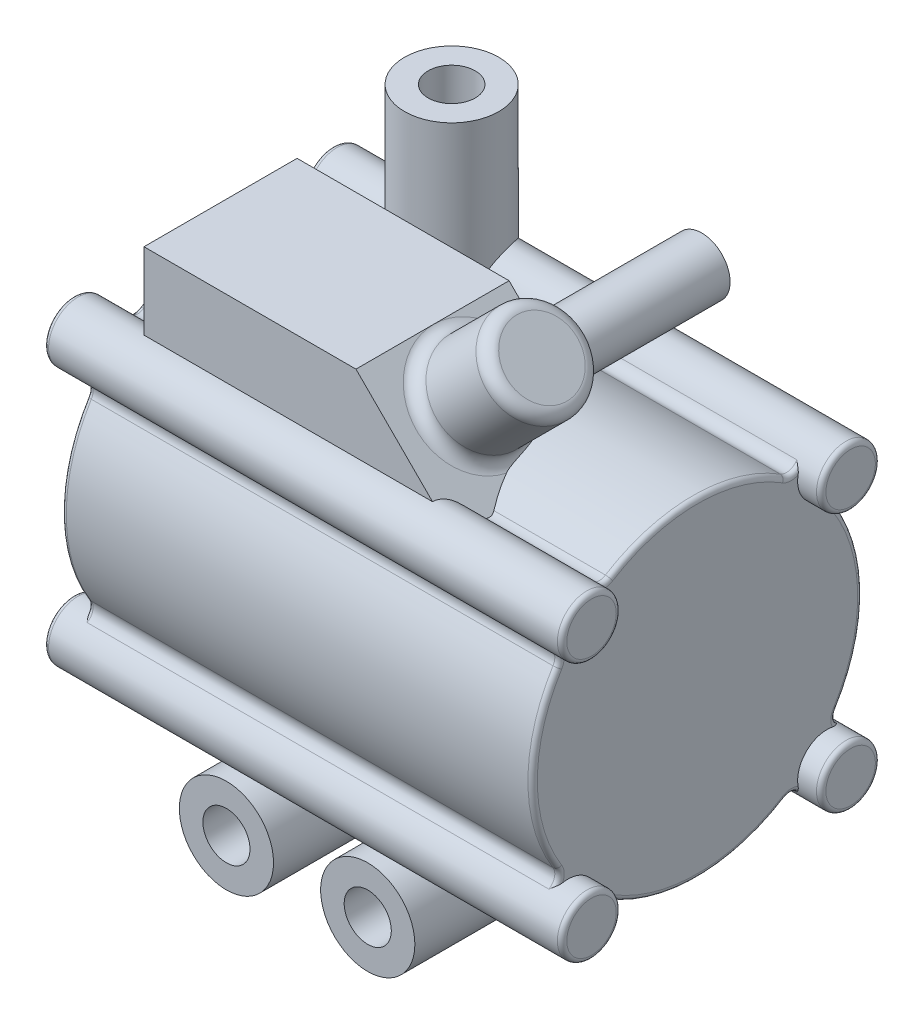
from build123d import *
from build123d.topology import SkipClean

# Parameters (mm, degrees)
BOSS_EXTRUDE1_DEPTH      = 50
BOSS_EXTRUDE1_DEPTH_BACK = 50
BOSS_EXTRUDE2_DEPTH      = 55
BOSS_EXTRUDE2_DEPTH_BACK = 55
SKETCH2_R                = 6.25
FILLET1_R                = 1
FILLET2_R                = 1
BOSS_EXTRUDE3_DEPTH      = 35
BOSS_EXTRUDE3_DEPTH_BACK = 35
SKETCH3_R                = 10
SKETCH3_R_2              = 5
SKETCH4_R                = 10
SKETCH4_R_2              = 5
BOSS_EXTRUDE5_DEPTH      = 60
BOSS_EXTRUDE6_DEPTH      = 27.5
BOSS_EXTRUDE6_DEPTH_BACK = 5
SKETCH8_R                = 10
BOSS_EXTRUDE7_DEPTH      = 20
BOSS_EXTRUDE8_DEPTH      = 10
BOSS_EXTRUDE8_DEPTH_BACK = 30
SKETCH9_R                = 6
SKETCH9_R_2              = 4
FILLET3_R                = 2.5
SKETCH10_R               = 7.5
CUT_EXTRUDE1_DEPTH       = 20
BOSS_EXTRUDE9_START      = 7.5
SKETCH11_R               = 10
SKETCH11_R_2             = 7.5
BOSS_EXTRUDE9_DEPTH      = 7.5


with BuildPart() as part:
    # Sketch1 → Boss-Extrude1 (new, two sides: drawn at the far end of the back side and taken through both)
    with BuildSketch(Plane(origin=(0, 0, 0), x_dir=(0, 0, -1), z_dir=(1, 0, 0)).offset(-BOSS_EXTRUDE1_DEPTH_BACK)):
        with BuildLine():
            ThreePointArc((18.553049004, 29.678011602), (0, 35), (-18.553049004, 29.678011602))
            ThreePointArc((-18.553049004, 29.678011602), (-20.495133355, 29.375169501), (-22.05590485, 30.569906838))
            ThreePointArc((-22.05590485, 30.569906838), (-31.919417382, 31.919417382), (-30.569906838, 22.05590485))
            ThreePointArc((-30.569906838, 22.05590485), (-29.375169501, 20.495133355), (-29.678011602, 18.553049004))
            ThreePointArc((-29.678011602, 18.553049004), (-35, 0), (-29.678011602, -18.553049004))
            ThreePointArc((-29.678011602, -18.553049004), (-29.375169501, -20.495133355), (-30.569906838, -22.05590485))
            ThreePointArc((-30.569906838, -22.05590485), (-31.919417382, -31.919417382), (-22.05590485, -30.569906838))
            ThreePointArc((-22.05590485, -30.569906838), (-20.495133355, -29.375169501), (-18.553049004, -29.678011602))
            ThreePointArc((-18.553049004, -29.678011602), (0, -35), (18.553049004, -29.678011602))
            ThreePointArc((18.553049004, -29.678011602), (20.495133355, -29.375169501), (22.05590485, -30.569906838))
            ThreePointArc((22.05590485, -30.569906838), (31.919417382, -31.919417382), (30.569906838, -22.05590485))
            ThreePointArc((30.569906838, -22.05590485), (29.375169501, -20.495133355), (29.678011602, -18.553049004))
            ThreePointArc((29.678011602, -18.553049004), (35, 0), (29.678011602, 18.553049004))
            ThreePointArc((29.678011602, 18.553049004), (29.375169501, 20.495133355), (30.569906838, 22.05590485))
            ThreePointArc((30.569906838, 22.05590485), (31.919417382, 31.919417382), (22.05590485, 30.569906838))
            ThreePointArc((22.05590485, 30.569906838), (20.495133355, 29.375169501), (18.553049004, 29.678011602))
        make_face()
    extrude(amount=BOSS_EXTRUDE1_DEPTH + BOSS_EXTRUDE1_DEPTH_BACK)

    # Sketch2 → Boss-Extrude2 (add, two sides: drawn at the far end of the back side and taken through both)
    with SkipClean():  # the faces are left unmerged after this step: merging them gives an invalid solid
        with BuildSketch(Plane(origin=(0, 0, 0), x_dir=(0, 0, -1), z_dir=(1, 0, 0)).offset(-BOSS_EXTRUDE2_DEPTH_BACK)):
            with Locations((-27.5, 27.5)):
                Circle(SKETCH2_R)
            with Locations((27.5, 27.5)):
                Circle(SKETCH2_R)
            with Locations((27.5, -27.5)):
                Circle(SKETCH2_R)
            with Locations((-27.5, -27.5)):
                Circle(SKETCH2_R)
        extrude(amount=BOSS_EXTRUDE2_DEPTH + BOSS_EXTRUDE2_DEPTH_BACK)
    add(part.part.scale(1), mode=Mode.REPLACE)  # the faces are merged on a copy

    # Fillet1
    fillet1_edges = [part.edges().sort_by_distance(p)[0] for p in [
        (-55, -27.5, 33.75),
        (55, -27.5, 33.75),
        (-55, 27.5, 33.75),
        (55, 27.5, 33.75),
        (-55, 27.5, -21.25),
        (55, 27.5, -21.25),
        (-55, -27.5, -21.25),
        (55, -27.5, -21.25),
    ]]
    fillet(fillet1_edges, radius=FILLET1_R)

    # Fillet2
    # the kernel refuses this fillet: 1 mm, written as the material it takes off along each edge
    with BuildSketch(Plane(origin=(50, 31.797869574, -19.87826679), x_dir=(0, 0.46795506701056017, -0.8837522589838976), z_dir=(0, 0.8837522589838976, 0.46795506701056017))) as fillet2_piece_1_section:
        with BuildLine():
            CenterArc((2.5 + FILLET2_R, FILLET2_R), FILLET2_R, 180, 90)
            Line((2.5 + FILLET2_R, 0), (2.5, 0))
            Line((2.5, 0), (2.5, FILLET2_R))
        make_face()
    fillet2_piece_1 = revolve(axis=Axis((50, 31.797869574, -19.87826679), (-1, 0, 0)), revolution_arc=149.912978169, mode=Mode.PRIVATE)
    fillet2_piece_1 = fillet2_piece_1 - Plane(origin=(49.747342596, 27.5, -27.5), x_dir=(0, 0, -1), z_dir=(-1, 0, 0)) * Cylinder(6.25, 15, mode=Mode.PRIVATE)
    add(fillet2_piece_1, mode=Mode.SUBTRACT)
    with BuildSketch(Plane(origin=(50, 0, 0), x_dir=(0, 0.8479431886343233, -0.5300871143959797), z_dir=(0, -0.5300871143959797, -0.8479431886343233))) as fillet2_piece_2:
        with BuildLine():
            CenterArc((35 - FILLET2_R, -FILLET2_R), FILLET2_R, 0, 90)
            Line((35, -FILLET2_R), (35, 0))
            Line((35, 0), (35 - FILLET2_R, 0))
        make_face()
    revolve(axis=Axis((50, 0, 0), (1, 0, 0)), revolution_arc=64.02268197, mode=Mode.SUBTRACT)
    with BuildSketch(Plane(origin=(50, 31.797869574, 19.87826679), x_dir=(0, -0.8479431886343237, -0.5300871143959789), z_dir=(0, 0.5300871143959789, -0.8479431886343237))) as fillet2_piece_3_section:
        with BuildLine():
            CenterArc((2.5 + FILLET2_R, FILLET2_R), FILLET2_R, 180, 90)
            Line((2.5, FILLET2_R), (2.5, 0))
            Line((2.5, 0), (2.5 + FILLET2_R, 0))
        make_face()
    fillet2_piece_3 = revolve(axis=Axis((50, 31.797869574, 19.87826679), (-1, 0, 0)), revolution_arc=149.912978169, mode=Mode.PRIVATE)
    fillet2_piece_3 = fillet2_piece_3 - Plane(origin=(49.836395702, 27.5, 27.5), x_dir=(0, 0, -1), z_dir=(-1, 0, 0)) * Cylinder(6.25, 15, mode=Mode.PRIVATE)
    add(fillet2_piece_3, mode=Mode.SUBTRACT)
    with BuildSketch(Plane(origin=(50, 19.87826679, 31.797869574), x_dir=(0, 0.8837522589838976, 0.46795506701056017), z_dir=(0, -0.46795506701056017, 0.8837522589838976))) as fillet2_piece_4_section:
        with BuildLine():
            CenterArc((2.5 + FILLET2_R, FILLET2_R), FILLET2_R, 180, 90)
            Line((2.5, FILLET2_R), (2.5, 0))
            Line((2.5, 0), (2.5 + FILLET2_R, 0))
        make_face()
    fillet2_piece_4 = revolve(axis=Axis((50, 19.87826679, 31.797869574), (-1, 0, 0)), revolution_arc=149.912978169, mode=Mode.PRIVATE)
    fillet2_piece_4 = fillet2_piece_4 - Plane(origin=(49.747342634, 27.5, 27.5), x_dir=(0, 0, -1), z_dir=(-1, 0, 0)) * Cylinder(6.25, 15, mode=Mode.PRIVATE)
    add(fillet2_piece_4, mode=Mode.SUBTRACT)
    with BuildSketch(Plane(origin=(50, 0, 0), x_dir=(0, 0.5300871143959798, 0.8479431886343232), z_dir=(0, 0.8479431886343232, -0.5300871143959798))) as fillet2_piece_5:
        with BuildLine():
            CenterArc((35 - FILLET2_R, -FILLET2_R), FILLET2_R, 0, 90)
            Line((35, -FILLET2_R), (35, 0))
            Line((35, 0), (35 - FILLET2_R, 0))
        make_face()
    revolve(axis=Axis((50, 0, 0), (1, 0, 0)), revolution_arc=64.02268197, mode=Mode.SUBTRACT)
    with BuildSketch(Plane(origin=(50, -19.87826679, 31.797869574), x_dir=(0, 0.5300871143959799, -0.8479431886343232), z_dir=(0, 0.8479431886343232, 0.5300871143959799))) as fillet2_piece_6_section:
        with BuildLine():
            CenterArc((2.5 + FILLET2_R, FILLET2_R), FILLET2_R, 180, 90)
            Line((2.5, FILLET2_R), (2.5, 0))
            Line((2.5, 0), (2.5 + FILLET2_R, 0))
        make_face()
    fillet2_piece_6 = revolve(axis=Axis((50, -19.87826679, 31.797869574), (-1, 0, 0)), revolution_arc=149.912978169, mode=Mode.PRIVATE)
    fillet2_piece_6 = fillet2_piece_6 - Plane(origin=(49.836395702, -27.5, 27.5), x_dir=(0, 0, -1), z_dir=(-1, 0, 0)) * Cylinder(6.25, 15, mode=Mode.PRIVATE)
    add(fillet2_piece_6, mode=Mode.SUBTRACT)
    with BuildSketch(Plane(origin=(-50, 19.87826679, -31.797869574), x_dir=(0, -0.5300871143959834, 0.8479431886343209), z_dir=(0, -0.8479431886343209, -0.5300871143959834))) as fillet2_piece_7_section:
        with BuildLine():
            CenterArc((2.5 + FILLET2_R, -FILLET2_R), FILLET2_R, 90, 90)
            Line((2.5, -FILLET2_R), (2.5, 0))
            Line((2.5, 0), (2.5 + FILLET2_R, 0))
        make_face()
    fillet2_piece_7 = revolve(axis=Axis((-50, 19.87826679, -31.797869574), (-1, 0, 0)), revolution_arc=149.912978169, mode=Mode.PRIVATE)
    fillet2_piece_7 = fillet2_piece_7 - Plane(origin=(-49.836395702, 27.5, -27.5), x_dir=(0, 0, -1), z_dir=(-1, 0, 0)) * Cylinder(6.25, 14, mode=Mode.PRIVATE)
    add(fillet2_piece_7, mode=Mode.SUBTRACT)
    with BuildSketch(Plane(origin=(-50, 0, 0), x_dir=(0, -0.5300871143959799, -0.8479431886343232), z_dir=(0, -0.8479431886343232, 0.5300871143959799))) as fillet2_piece_8:
        with BuildLine():
            CenterArc((35 - FILLET2_R, FILLET2_R), FILLET2_R, 270, 90)
            Line((35, FILLET2_R), (35, 0))
            Line((35, 0), (35 - FILLET2_R, 0))
        make_face()
    revolve(axis=Axis((-50, 0, 0), (1, 0, 0)), revolution_arc=64.02268197, mode=Mode.SUBTRACT)
    with BuildSketch(Plane(origin=(-50, -19.87826679, -31.797869574), x_dir=(0, -0.8837522589838976, -0.46795506701056017), z_dir=(0, 0.46795506701056017, -0.8837522589838976))) as fillet2_piece_9_section:
        with BuildLine():
            CenterArc((2.5 + FILLET2_R, -FILLET2_R), FILLET2_R, 90, 90)
            Line((2.5, -FILLET2_R), (2.5, 0))
            Line((2.5, 0), (2.5 + FILLET2_R, 0))
        make_face()
    fillet2_piece_9 = revolve(axis=Axis((-50, -19.87826679, -31.797869574), (-1, 0, 0)), revolution_arc=149.912978169, mode=Mode.PRIVATE)
    fillet2_piece_9 = fillet2_piece_9 - Plane(origin=(-49.747342593, -27.5, -27.5), x_dir=(0, -0.49118509414709893, 0.8710552240172293), z_dir=(-1, 0, 0)) * Cylinder(6.25, 15, mode=Mode.PRIVATE)
    add(fillet2_piece_9, mode=Mode.SUBTRACT)
    with BuildSketch(Plane(origin=(-50, -31.797869574, -19.87826679), x_dir=(0, 0.8479431886343237, 0.5300871143959789), z_dir=(0, -0.5300871143959789, 0.8479431886343237))) as fillet2_piece_10_section:
        with BuildLine():
            CenterArc((2.5 + FILLET2_R, -FILLET2_R), FILLET2_R, 90, 90)
            Line((2.5, -FILLET2_R), (2.5, 0))
            Line((2.5, 0), (2.5 + FILLET2_R, 0))
        make_face()
    fillet2_piece_10 = revolve(axis=Axis((-50, -31.797869574, -19.87826679), (-1, 0, 0)), revolution_arc=149.912978169, mode=Mode.PRIVATE)
    fillet2_piece_10 = fillet2_piece_10 - Plane(origin=(-49.836395702, -27.5, -27.5), x_dir=(0, -0.49118509414709893, 0.8710552240172293), z_dir=(-1, 0, 0)) * Cylinder(6.25, 15, mode=Mode.PRIVATE)
    add(fillet2_piece_10, mode=Mode.SUBTRACT)
    with BuildSketch(Plane(origin=(-50, 0, 0), x_dir=(0, -0.8479431886343233, 0.5300871143959798), z_dir=(0, 0.5300871143959798, 0.8479431886343233))) as fillet2_piece_11:
        with BuildLine():
            CenterArc((35 - FILLET2_R, FILLET2_R), FILLET2_R, 270, 90)
            Line((35, FILLET2_R), (35, 0))
            Line((35, 0), (35 - FILLET2_R, 0))
        make_face()
    revolve(axis=Axis((-50, 0, 0), (1, 0, 0)), revolution_arc=64.02268197, mode=Mode.SUBTRACT)
    with BuildSketch(Plane(origin=(-50, -31.797869574, 19.87826679), x_dir=(0, -0.46795506701056017, 0.8837522589838976), z_dir=(0, -0.8837522589838976, -0.46795506701056017))) as fillet2_piece_12_section:
        with BuildLine():
            CenterArc((2.5 + FILLET2_R, -FILLET2_R), FILLET2_R, 90, 90)
            Line((2.5, -FILLET2_R), (2.5, 0))
            Line((2.5, 0), (2.5 + FILLET2_R, 0))
        make_face()
    fillet2_piece_12 = revolve(axis=Axis((-50, -31.797869574, 19.87826679), (-1, 0, 0)), revolution_arc=149.912978169, mode=Mode.PRIVATE)
    fillet2_piece_12 = fillet2_piece_12 - Plane(origin=(-49.747302505, -27.5, 27.5), x_dir=(0, 0, -1), z_dir=(-1, 0, 0)) * Cylinder(6.25, 15, mode=Mode.PRIVATE)
    add(fillet2_piece_12, mode=Mode.SUBTRACT)
    with BuildSketch(Plane(origin=(-50, -19.87826679, 31.797869574), x_dir=(0, 0.5300871143959799, -0.8479431886343232), z_dir=(0, 0.8479431886343232, 0.5300871143959799))) as fillet2_piece_13_section:
        with BuildLine():
            CenterArc((2.5 + FILLET2_R, -FILLET2_R), FILLET2_R, 90, 90)
            Line((2.5, -FILLET2_R), (2.5, 0))
            Line((2.5, 0), (2.5 + FILLET2_R, 0))
        make_face()
    fillet2_piece_13 = revolve(axis=Axis((-50, -19.87826679, 31.797869574), (-1, 0, 0)), revolution_arc=149.912978169, mode=Mode.PRIVATE)
    fillet2_piece_13 = fillet2_piece_13 - Plane(origin=(-49.836395702, -27.5, 27.5), x_dir=(0, 0, -1), z_dir=(-1, 0, 0)) * Cylinder(6.25, 15, mode=Mode.PRIVATE)
    add(fillet2_piece_13, mode=Mode.SUBTRACT)
    with BuildSketch(Plane(origin=(-50, 0, 0), x_dir=(0, 0.5300871143959798, 0.8479431886343232), z_dir=(0, 0.8479431886343232, -0.5300871143959798))) as fillet2_piece_14:
        with BuildLine():
            CenterArc((35 - FILLET2_R, FILLET2_R), FILLET2_R, 270, 90)
            Line((35, FILLET2_R), (35, 0))
            Line((35, 0), (35 - FILLET2_R, 0))
        make_face()
    revolve(axis=Axis((-50, 0, 0), (1, 0, 0)), revolution_arc=64.02268197, mode=Mode.SUBTRACT)
    with BuildSketch(Plane(origin=(-50, 19.87826679, 31.797869574), x_dir=(0, 0.8837522589838976, 0.46795506701056017), z_dir=(0, -0.46795506701056017, 0.8837522589838976))) as fillet2_piece_15_section:
        with BuildLine():
            CenterArc((2.5 + FILLET2_R, -FILLET2_R), FILLET2_R, 90, 90)
            Line((2.5, -FILLET2_R), (2.5, 0))
            Line((2.5, 0), (2.5 + FILLET2_R, 0))
        make_face()
    fillet2_piece_15 = revolve(axis=Axis((-50, 19.87826679, 31.797869574), (-1, 0, 0)), revolution_arc=149.912978169, mode=Mode.PRIVATE)
    fillet2_piece_15 = fillet2_piece_15 - Plane(origin=(-49.747342634, 27.5, 27.5), x_dir=(0, 0, -1), z_dir=(-1, 0, 0)) * Cylinder(6.25, 15, mode=Mode.PRIVATE)
    add(fillet2_piece_15, mode=Mode.SUBTRACT)
    with BuildSketch(Plane(origin=(-50, 31.797869574, 19.87826679), x_dir=(0, -0.8479431886343237, -0.5300871143959789), z_dir=(0, 0.5300871143959789, -0.8479431886343237))) as fillet2_piece_16_section:
        with BuildLine():
            CenterArc((2.5 + FILLET2_R, -FILLET2_R), FILLET2_R, 90, 90)
            Line((2.5, -FILLET2_R), (2.5, 0))
            Line((2.5, 0), (2.5 + FILLET2_R, 0))
        make_face()
    fillet2_piece_16 = revolve(axis=Axis((-50, 31.797869574, 19.87826679), (-1, 0, 0)), revolution_arc=149.912978169, mode=Mode.PRIVATE)
    fillet2_piece_16 = fillet2_piece_16 - Plane(origin=(-49.836395702, 27.5, 27.5), x_dir=(0, 0, -1), z_dir=(-1, 0, 0)) * Cylinder(6.25, 15, mode=Mode.PRIVATE)
    add(fillet2_piece_16, mode=Mode.SUBTRACT)
    with BuildSketch(Plane(origin=(-50, 0, 0), x_dir=(0, 0.8479431886343233, -0.5300871143959797), z_dir=(0, -0.5300871143959797, -0.8479431886343233))) as fillet2_piece_17:
        with BuildLine():
            CenterArc((35 - FILLET2_R, FILLET2_R), FILLET2_R, 270, 90)
            Line((35, FILLET2_R), (35, 0))
            Line((35, 0), (35 - FILLET2_R, 0))
        make_face()
    revolve(axis=Axis((-50, 0, 0), (1, 0, 0)), revolution_arc=64.02268197, mode=Mode.SUBTRACT)
    with BuildSketch(Plane(origin=(-50, 31.797869574, -19.87826679), x_dir=(0, 0.46795506701056017, -0.8837522589838976), z_dir=(0, 0.8837522589838976, 0.46795506701056017))) as fillet2_piece_18_section:
        with BuildLine():
            CenterArc((2.5 + FILLET2_R, -FILLET2_R), FILLET2_R, 90, 90)
            Line((2.5, -FILLET2_R), (2.5, 0))
            Line((2.5, 0), (2.5 + FILLET2_R, 0))
        make_face()
    fillet2_piece_18 = revolve(axis=Axis((-50, 31.797869574, -19.87826679), (-1, 0, 0)), revolution_arc=149.912978169, mode=Mode.PRIVATE)
    fillet2_piece_18 = fillet2_piece_18 - Plane(origin=(-49.747342593, 27.5, -27.5), x_dir=(0, 0, -1), z_dir=(-1, 0, 0)) * Cylinder(6.25, 15, mode=Mode.PRIVATE)
    add(fillet2_piece_18, mode=Mode.SUBTRACT)
    with BuildSketch(Plane(origin=(50, -31.797869574, 19.87826679), x_dir=(0, -0.46795506701056017, 0.8837522589838976), z_dir=(0, -0.8837522589838976, -0.46795506701056017))) as fillet2_piece_19_section:
        with BuildLine():
            CenterArc((2.5 + FILLET2_R, FILLET2_R), FILLET2_R, 180, 90)
            Line((2.5, FILLET2_R), (2.5, 0))
            Line((2.5, 0), (2.5 + FILLET2_R, 0))
        make_face()
    fillet2_piece_19 = revolve(axis=Axis((50, -31.797869574, 19.87826679), (-1, 0, 0)), revolution_arc=149.912978169, mode=Mode.PRIVATE)
    fillet2_piece_19 = fillet2_piece_19 - Plane(origin=(49.747302505, -27.5, 27.5), x_dir=(0, 0, -1), z_dir=(-1, 0, 0)) * Cylinder(6.25, 15, mode=Mode.PRIVATE)
    add(fillet2_piece_19, mode=Mode.SUBTRACT)
    with BuildSketch(Plane(origin=(50, 0, 0), x_dir=(0, -0.8479431886343233, 0.5300871143959798), z_dir=(0, 0.5300871143959798, 0.8479431886343233))) as fillet2_piece_20:
        with BuildLine():
            CenterArc((35 - FILLET2_R, -FILLET2_R), FILLET2_R, 0, 90)
            Line((35, -FILLET2_R), (35, 0))
            Line((35, 0), (35 - FILLET2_R, 0))
        make_face()
    revolve(axis=Axis((50, 0, 0), (1, 0, 0)), revolution_arc=64.02268197, mode=Mode.SUBTRACT)
    with BuildSketch(Plane(origin=(50, 19.87826679, -31.797869574), x_dir=(0, -0.5300871143959834, 0.8479431886343209), z_dir=(0, -0.8479431886343209, -0.5300871143959834))) as fillet2_piece_21_section:
        with BuildLine():
            CenterArc((2.5 + FILLET2_R, FILLET2_R), FILLET2_R, 180, 90)
            Line((2.5 + FILLET2_R, 0), (2.5, 0))
            Line((2.5, 0), (2.5, FILLET2_R))
        make_face()
    fillet2_piece_21 = revolve(axis=Axis((50, 19.87826679, -31.797869574), (-1, 0, 0)), revolution_arc=149.912978169, mode=Mode.PRIVATE)
    fillet2_piece_21 = fillet2_piece_21 - Plane(origin=(49.747342594, 27.5, -27.5), x_dir=(0, 0, -1), z_dir=(-1, 0, 0)) * Cylinder(6.25, 14, mode=Mode.PRIVATE)
    add(fillet2_piece_21, mode=Mode.SUBTRACT)
    with BuildSketch(Plane(origin=(50, -31.797869574, -19.87826679), x_dir=(0, 0.8479431886343237, 0.5300871143959789), z_dir=(0, -0.5300871143959789, 0.8479431886343237))) as fillet2_piece_22_section:
        with BuildLine():
            CenterArc((2.5 + FILLET2_R, FILLET2_R), FILLET2_R, 180, 90)
            Line((2.5, FILLET2_R), (2.5, 0))
            Line((2.5, 0), (2.5 + FILLET2_R, 0))
        make_face()
    fillet2_piece_22 = revolve(axis=Axis((50, -31.797869574, -19.87826679), (-1, 0, 0)), revolution_arc=149.912978169, mode=Mode.PRIVATE)
    fillet2_piece_22 = fillet2_piece_22 - Plane(origin=(49.836395702, -27.5, -27.5), x_dir=(0, -0.49118509414709893, 0.8710552240172293), z_dir=(-1, 0, 0)) * Cylinder(6.25, 15, mode=Mode.PRIVATE)
    add(fillet2_piece_22, mode=Mode.SUBTRACT)
    with BuildSketch(Plane(origin=(50, -19.87826679, -31.797869574), x_dir=(0, -0.8837522589838976, -0.46795506701056017), z_dir=(0, 0.46795506701056017, -0.8837522589838976))) as fillet2_piece_23_section:
        with BuildLine():
            CenterArc((2.5 + FILLET2_R, FILLET2_R), FILLET2_R, 180, 90)
            Line((2.5, FILLET2_R), (2.5, 0))
            Line((2.5, 0), (2.5 + FILLET2_R, 0))
        make_face()
    fillet2_piece_23 = revolve(axis=Axis((50, -19.87826679, -31.797869574), (-1, 0, 0)), revolution_arc=149.912978169, mode=Mode.PRIVATE)
    fillet2_piece_23 = fillet2_piece_23 - Plane(origin=(49.747342593, -27.5, -27.5), x_dir=(0, -0.49118509414709893, 0.8710552240172293), z_dir=(-1, 0, 0)) * Cylinder(6.25, 15, mode=Mode.PRIVATE)
    add(fillet2_piece_23, mode=Mode.SUBTRACT)
    with BuildSketch(Plane(origin=(50, 0, 0), x_dir=(0, -0.5300871143959799, -0.8479431886343232), z_dir=(0, -0.8479431886343232, 0.5300871143959799))) as fillet2_piece_24:
        with BuildLine():
            CenterArc((35 - FILLET2_R, -FILLET2_R), FILLET2_R, 0, 90)
            Line((35, -FILLET2_R), (35, 0))
            Line((35, 0), (35 - FILLET2_R, 0))
        make_face()
    revolve(axis=Axis((50, 0, 0), (1, 0, 0)), revolution_arc=64.02268197, mode=Mode.SUBTRACT)

    # Sketch3 → Boss-Extrude3 (add, two sides: drawn at the far end of the back side and taken through both)
    # profile 1 of 2: a face of its own
    with SkipClean():  # the faces are left unmerged after this step: merging them gives an invalid solid
        with BuildSketch(Plane.XY.offset(-BOSS_EXTRUDE3_DEPTH_BACK)):
            with Locations((15, -42)):
                Circle(SKETCH3_R)
            with Locations((15, -42)):
                Circle(SKETCH3_R_2, mode=Mode.SUBTRACT)
        # profile 2 of 2: a face of its own
        with BuildSketch(Plane.XY.offset(-BOSS_EXTRUDE3_DEPTH_BACK)):
            with Locations((-15, -42)):
                Circle(SKETCH3_R)
            with Locations((-15, -42)):
                Circle(SKETCH3_R_2, mode=Mode.SUBTRACT)
        extrude(amount=BOSS_EXTRUDE3_DEPTH + BOSS_EXTRUDE3_DEPTH_BACK)

    # Sketch4 → Boss-Extrude5 (add)
    with SkipClean():  # the faces are left unmerged after this step: merging them gives an invalid solid
        with BuildSketch(Plane(origin=(0, 0, 0), x_dir=(1, 0, 0), z_dir=(0, 1, 0))):
            with Locations(Location((-27.182383011, 25, 0), (0, 0, 90))):
                Circle(SKETCH4_R)
            with Locations(Location((-27.182383011, 25, 0), (0, 0, 323.926752296))):
                Circle(SKETCH4_R_2, mode=Mode.SUBTRACT)
        extrude(amount=BOSS_EXTRUDE5_DEPTH)

    # Sketch7 → Boss-Extrude6 (add, two sides: drawn at the far end of the back side and taken through both)
    with SkipClean():  # the faces are left unmerged after this step: merging them gives an invalid solid
        with BuildSketch(Plane.XY.offset(-BOSS_EXTRUDE6_DEPTH_BACK)):
            Polygon((-40, 25), (-40, 50), (5, 50), (30, 25), align=None)
        extrude(amount=BOSS_EXTRUDE6_DEPTH + BOSS_EXTRUDE6_DEPTH_BACK)

    # Sketch8 → Boss-Extrude7 (add)
    with SkipClean():  # the faces are left unmerged after this step: merging them gives an invalid solid
        with BuildSketch(Plane(origin=(27.5, 27.5, 0), x_dir=(0, 0, -1), z_dir=(0.7071067811865435, 0.7071067811865517, 0))):
            with Locations(Location((-11, 19.319805153, 0), (0, 0, 90))):
                Circle(SKETCH8_R)
        extrude(amount=BOSS_EXTRUDE7_DEPTH)

    # Sketch9 → Boss-Extrude8 (add, two sides: drawn at the far end of the back side and taken through both)
    with SkipClean():  # the faces are left unmerged after this step: merging them gives an invalid solid
        with BuildSketch(Plane.XY.offset(-BOSS_EXTRUDE8_DEPTH_BACK)):
            with Locations((20.909902577, 48.232233047)):
                Circle(SKETCH9_R)
            with Locations((20.909902577, 48.232233047)):
                Circle(SKETCH9_R_2, mode=Mode.SUBTRACT)
        extrude(amount=BOSS_EXTRUDE8_DEPTH + BOSS_EXTRUDE8_DEPTH_BACK)

    # Fillet3
    # the kernel refuses this fillet: 2.5 mm, written as the material it adds along each edge
    with BuildSketch(Plane(origin=(13.838834765, 41.161165235, 11), x_dir=(-0.7071067811865515, 0.7071067811865435, 0), z_dir=(0, 0, -1))) as fillet3_piece_1:
        with BuildLine():
            CenterArc((10 + FILLET3_R, FILLET3_R), FILLET3_R, 180, 90)
            Line((10, FILLET3_R), (10, 0))
            Line((10, 0), (10 + FILLET3_R, 0))
        make_face()
    revolve(axis=Axis((13.838834765, 41.161165235, 11), (0.7071067811865435, 0.7071067811865517, 0)))
    # the kernel refuses this fillet: 2.5 mm, written as the material it takes off along each edge
    with BuildSketch(Plane(origin=(27.980970389, 55.303300859, 11), x_dir=(-0.7071067811865519, 0.707106781186543, 0), z_dir=(0, 0, -1))) as fillet3_2_piece_1:
        with BuildLine():
            CenterArc((10 - FILLET3_R, -FILLET3_R), FILLET3_R, 360, 90)
            Line((10 - FILLET3_R, 0), (10, 0))
            Line((10, 0), (10, -FILLET3_R))
        make_face()
    revolve(axis=Axis((27.980970389, 55.303300859, 11), (0.7071067811865435, 0.7071067811865517, 0)), mode=Mode.SUBTRACT)

    # Sketch10 → Cut-Extrude1 (cut)
    with BuildSketch(Plane.ZY.offset(50)):
        Circle(SKETCH10_R)
    extrude(amount=-CUT_EXTRUDE1_DEPTH, mode=Mode.SUBTRACT)

    # Sketch11 → Boss-Extrude9 (add)
    with BuildSketch(Plane.ZY.offset(50).offset(BOSS_EXTRUDE9_START)):
        Circle(SKETCH11_R)
        Circle(SKETCH11_R_2, mode=Mode.SUBTRACT)
    extrude(amount=-BOSS_EXTRUDE9_DEPTH)


solid = part.part
